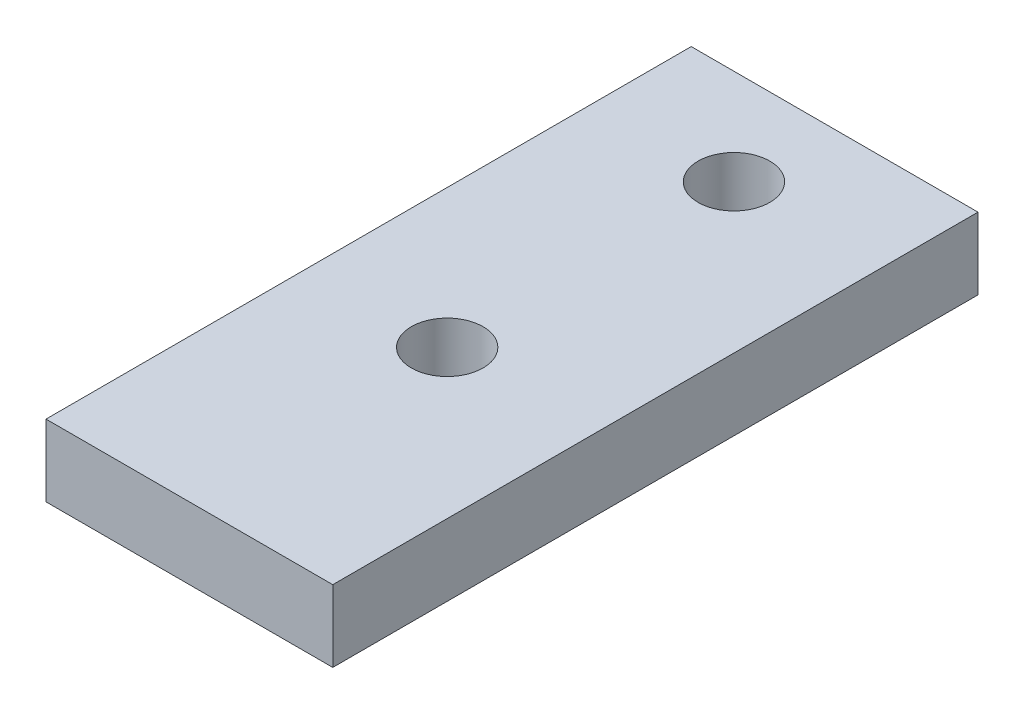
from build123d import *

# Parameters (mm, degrees)
SZKIC1_W                    = 40
SZKIC1_H                    = 90
SZKIC1_R                    = 5
DODANIE_WYCI_GNI_CIE1_DEPTH = 10


with BuildPart() as part:
    # Szkic1 → Dodanie-wyciągnięcie1 (new body)
    with BuildSketch(Plane(origin=(0, 0, 0), x_dir=(1, 0, 0), z_dir=(0, 1, 0))):
        with Locations((20, 45)):
            Rectangle(SZKIC1_W, SZKIC1_H)
        with Locations((19.31, 76.65)):
            Circle(SZKIC1_R, mode=Mode.SUBTRACT)
        with Locations((19.31, 36.65)):
            Circle(SZKIC1_R, mode=Mode.SUBTRACT)
    extrude(amount=DODANIE_WYCI_GNI_CIE1_DEPTH)


solid = part.part
